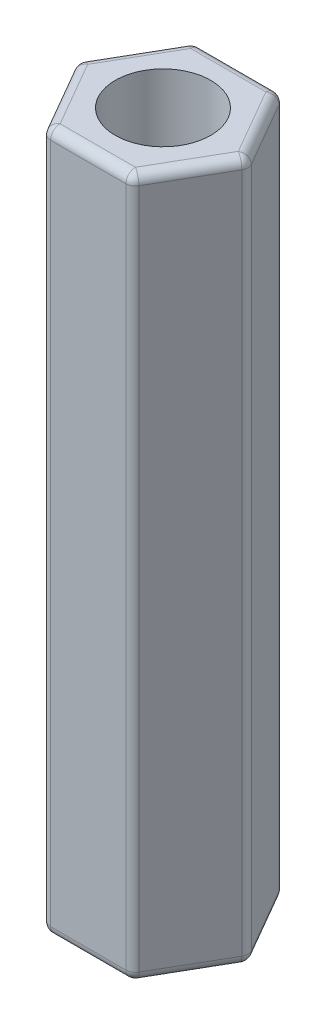
from build123d import *

# Parameters (mm, degrees)
SKETCH_1_R      = 1.5
EXTRUDE_1_DEPTH = 22
FILLET_1_R      = 0.3


with BuildPart() as part:
    # 草图1 → 凸台-拉伸1 (new body)
    with BuildSketch(Plane(origin=(0, 0, 0), x_dir=(1, 0, 0), z_dir=(0, 1, 0))):
        Polygon((2.713546265, 0), (1.356773133, 2.35), (-1.356773133, 2.35), (-2.713546265, 0), (-1.356773133, -2.35), (1.356773133, -2.35), align=None)
        Circle(SKETCH_1_R, mode=Mode.SUBTRACT)
    extrude(amount=EXTRUDE_1_DEPTH)

    # 圆角1
    fillet_1_edges = [part.edges().sort_by_distance(p)[0] for p in [
        (2.713546265, 11, 0),
        (1.356773133, 11, -2.35),
        (-1.356773133, 11, -2.35),
        (-2.713546265, 11, 0),
        (-1.356773133, 11, 2.35),
        (1.356773133, 11, 2.35),
        (0, 22, 2.35),
        (-2.035159699, 22, 1.175),
        (-2.035159699, 22, -1.175),
        (0, 22, -2.35),
        (2.035159699, 22, -1.175),
        (2.035159699, 22, 1.175),
        (0, 0, 2.35),
        (-2.035159699, 0, 1.175),
        (-2.035159699, 0, -1.175),
        (0, 0, -2.35),
        (2.035159699, 0, -1.175),
        (2.035159699, 0, 1.175),
    ]]
    fillet(fillet_1_edges, radius=FILLET_1_R)


solid = part.part
